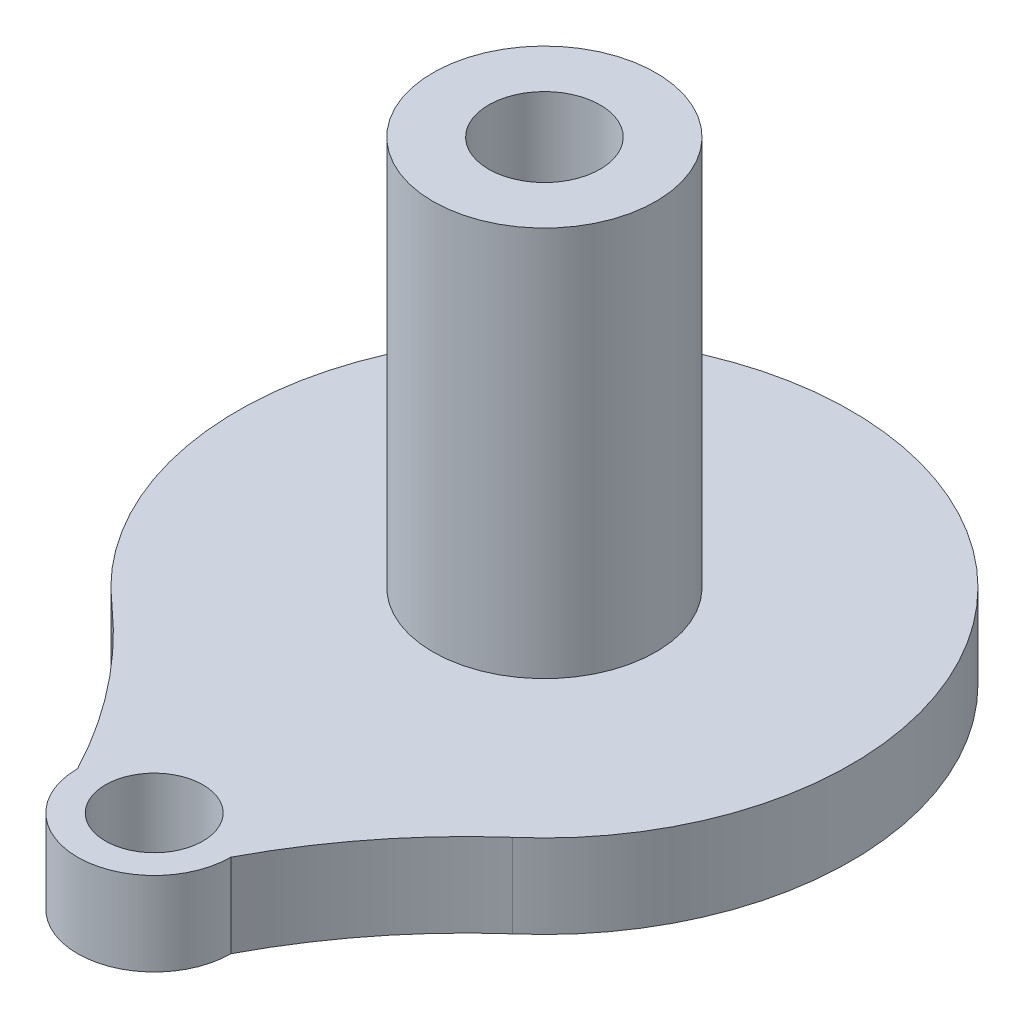
from build123d import *

# Parameters (mm, degrees)
SKETCH1_R               = 11
BOSS_EXTRUDE1_DEPTH     = 3
SKETCH2_R               = 4
BOSS_EXTRUDE2_DEPTH     = 14
SKETCH3_R               = 2
CUT_EXTRUDE1_DEPTH      = 20
BOSS_EXTRUDE3_START     = -3
BOSS_EXTRUDE3_OUTLINE_R = 1.75
BOSS_EXTRUDE3_DEPTH     = 3


# Read off the part's stored shape, not the designer's step: Boss-Extrude3
with BuildPart() as part:
    # Sketch1 → Boss-Extrude1 (new body)
    with BuildSketch(Plane(origin=(0, 0, 0), x_dir=(1, 0, 0), z_dir=(0, 1, 0))):
        with Locations(Location((0, 0, 0), (0, 0, 270))):
            Circle(SKETCH1_R)
    extrude(amount=BOSS_EXTRUDE1_DEPTH)

    # Sketch2 → Boss-Extrude2 (add)
    with BuildSketch(Plane(origin=(0, 3, 0), x_dir=(1, 0, 0), z_dir=(0, 1, 0))):
        with Locations(Location((0, 0, 0), (0, 0, 270))):
            Circle(SKETCH2_R)
    extrude(amount=BOSS_EXTRUDE2_DEPTH)

    # Sketch3 → Cut-Extrude1 (cut)
    with BuildSketch(Plane(origin=(0, 17, 0), x_dir=(1, 0, 0), z_dir=(0, 1, 0))):
        with Locations(Location((0, 0, 0), (0, 0, 270))):
            Circle(SKETCH3_R)
    extrude(amount=-CUT_EXTRUDE1_DEPTH, mode=Mode.SUBTRACT)

    # Boss-Extrude3 outline → Boss-Extrude3 (add)
    with BuildSketch(Plane.XZ.offset(BOSS_EXTRUDE3_START)):
        with BuildLine():
            ThreePointArc((-2.75, 14), (-4.710548646, 10.963037737), (-7.185731367, 8.328581195))
            ThreePointArc((-7.185731367, 8.328581195), (0, 11), (7.185731367, 8.328581195))
            ThreePointArc((7.185731367, 8.328581195), (4.710548646, 10.963037737), (2.75, 14))
            ThreePointArc((2.75, 14), (0, 16.75), (-2.75, 14))
        make_face()
        with Locations((0, 14)):
            Circle(BOSS_EXTRUDE3_OUTLINE_R, mode=Mode.SUBTRACT)
    extrude(amount=BOSS_EXTRUDE3_DEPTH)


solid = part.part
